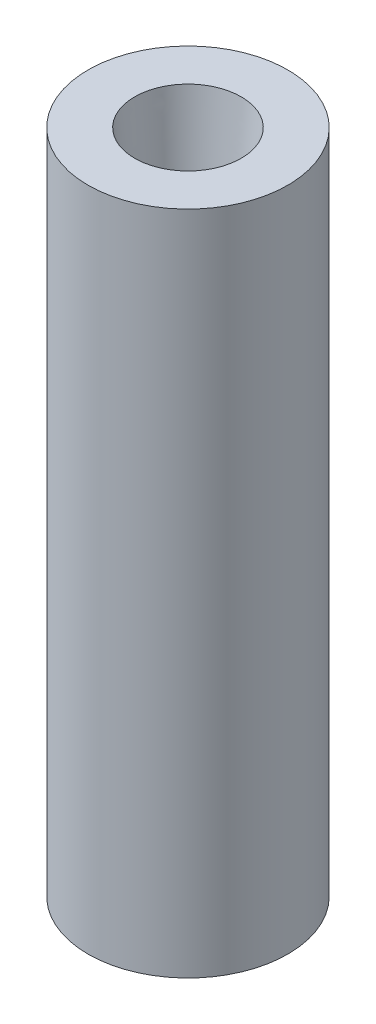
from build123d import *

# Parameters (mm, degrees)
SKETCH1_R           = 7.5
BOSS_EXTRUDE1_DEPTH = 50
SKETCH3_W           = 3.45
SKETCH3_H           = 3.45
CUT_EXTRUDE2_DEPTH  = 25


with BuildPart() as part:
    # Sketch1 → Boss-Extrude1 (new body)
    with BuildSketch(Plane(origin=(0, 0, 0), x_dir=(1, 0, 0), z_dir=(0, 1, 0))):
        with Locations(Location((0, 0, 0), (0, 0, 270))):
            Circle(SKETCH1_R)
    extrude(amount=BOSS_EXTRUDE1_DEPTH)

    # Sketch3 → Cut-Extrude2 (cut)
    with BuildSketch(Plane.XZ):
        Rectangle(SKETCH3_W, SKETCH3_H)
    extrude(amount=-CUT_EXTRUDE2_DEPTH, mode=Mode.SUBTRACT)

    # Cut-Loft2: read off the stored shape, not the designer's step
    # Cut-Loft2: loft between two sections, ruled curve by curve
    cut_loft2_from = [
        Edge.make_bspline([(-1.423347069, 25, -0.473374188), (-2.370095445, 25, 2.373319949), (0.476598692, 25, 3.320068326), (1.423347069, 25, 0.473374188), (2.370095445, 25, -2.373319949), (-0.476598692, 25, -3.320068326), (-1.423347069, 25, -0.473374188)], [0, 0, 0, 0, 0.5, 0.5, 0.5, 1, 1, 1, 1], 3, [1, 0.333333333, 0.333333333, 1, 0.333333333, 0.333333333, 1]),
    ]
    cut_loft2_to = [
        Edge.make_bspline([(-3.971230311, 50, -0.478883932), (-4.928998175, 50, 7.463576689), (3.013462446, 50, 8.421344553), (3.971230311, 50, 0.478883932), (4.928998175, 50, -7.463576689), (-3.013462446, 50, -8.421344553), (-3.971230311, 50, -0.478883932)], [0, 0, 0, 0, 0.5, 0.5, 0.5, 1, 1, 1, 1], 3, [1, 0.333333333, 0.333333333, 1, 0.333333333, 0.333333333, 1]),
    ]
    cut_loft2 = Solid(Shell([*[Face.make_surface_from_curves(cut_loft2_from[k], cut_loft2_to[k]) for k in range(1)], Face(Wire(cut_loft2_from)), Face(Wire(cut_loft2_to))]))
    add(cut_loft2, mode=Mode.SUBTRACT)


solid = part.part
